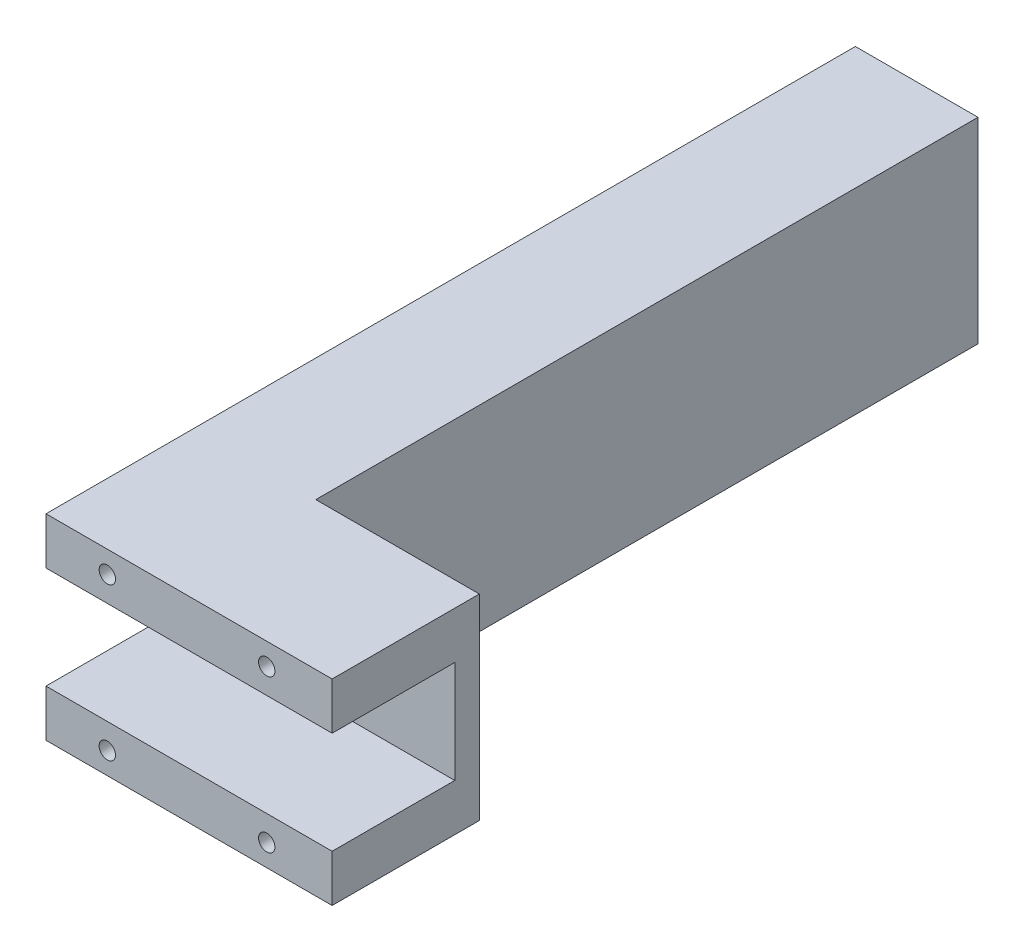
from build123d import *

# Parameters (mm, degrees)
CROQUIS1_W              = 70
CROQUIS1_H              = 48
SALIENTE_EXTRUIR1_DEPTH = 6
CROQUIS4_W              = 70
CROQUIS4_H              = 11.5
SALIENTE_EXTRUIR3_DEPTH = 30
CROQUIS5_R              = 2
CORTAR_EXTRUIR3_DEPTH   = 16
CROQUIS6_W              = 30
CROQUIS6_H              = 48
SALIENTE_EXTRUIR4_DEPTH = 162
CROQUIS7_R              = 2
CORTAR_EXTRUIR4_DEPTH   = 16


with BuildPart() as part:
    # Croquis1 → Saliente-Extruir1 (new body)
    with BuildSketch(Plane.XY):
        with Locations((-31.216216216, 7.011261261)):
            Rectangle(CROQUIS1_W, CROQUIS1_H)
    extrude(amount=SALIENTE_EXTRUIR1_DEPTH)

    # Croquis4 → Saliente-Extruir3 (add)
    with BuildSketch(Plane.XY.offset(6)):
        with Locations((-31.216216216, 25.261261261)):
            Rectangle(CROQUIS4_W, CROQUIS4_H)
        with Locations((-31.216216216, -11.238738739)):
            Rectangle(CROQUIS4_W, CROQUIS4_H)
    extrude(amount=SALIENTE_EXTRUIR3_DEPTH)

    # Croquis5 → Cortar-Extruir3 (cut)
    with BuildSketch(Plane.XY.offset(36)):
        with Locations((-51.216216216, 25.661261261)):
            Circle(CROQUIS5_R)
        with Locations((-12.216216216, 25.661261261)):
            Circle(CROQUIS5_R)
        with Locations((-12.216216216, -11.638738739)):
            Circle(CROQUIS5_R)
        with Locations((-51.216216216, -11.638738739)):
            Circle(CROQUIS5_R)
    extrude(amount=-CORTAR_EXTRUIR3_DEPTH, mode=Mode.SUBTRACT)

    # Croquis6 → Saliente-Extruir4 (add)
    with BuildSketch(Plane(origin=(0, 0, 0), x_dir=(-1, 0, 0), z_dir=(0, 0, -1))):
        with Locations((51.216216216, 7.011261261)):
            Rectangle(CROQUIS6_W, CROQUIS6_H)
    extrude(amount=SALIENTE_EXTRUIR4_DEPTH)

    # Croquis7 → Cortar-Extruir4 (cut)
    with BuildSketch(Plane(origin=(0, 0, -162), x_dir=(-1, 0, 0), z_dir=(0, 0, -1))):
        with Locations((51.216216216, 7.011261261)):
            Circle(CROQUIS7_R)
    extrude(amount=-CORTAR_EXTRUIR4_DEPTH, mode=Mode.SUBTRACT)


solid = part.part
